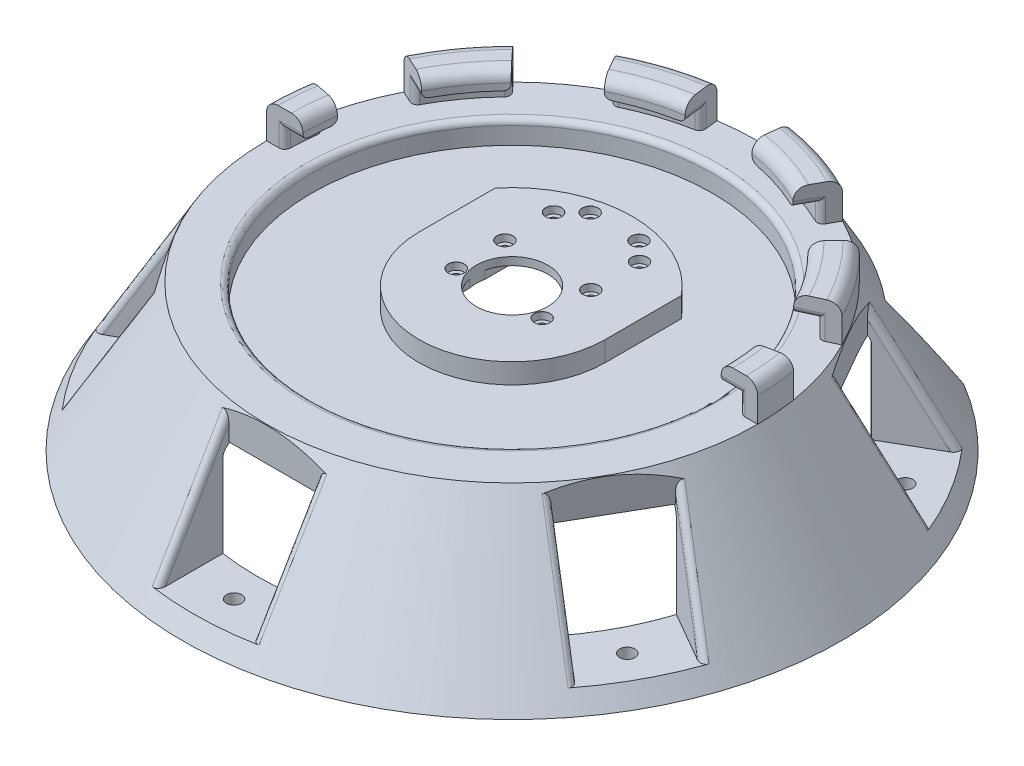
from build123d import *

# Parameters (mm, degrees)
SKETCH2_R                       = 12.5
CUT_EXTRUDE1_DEPTH              = 171.457229262
SKETCH3_R                       = 69.999999954
CUT_EXTRUDE2_DEPTH              = 8.000000002
CUT_EXTRUDE5_DEPTH              = 39
SKETCH8_W                       = 31.75
SKETCH8_H                       = 38.1
CUT_EXTRUDE6_DEPTH              = 44.45
CIRPATTERN2_COUNT               = 6
SKETCH9_R                       = 2.649982
CUT_EXTRUDE7_DEPTH              = 171.457229262
CIRPATTERN3_COUNT               = 6
REVOLVE2_ANGLE                  = 180
CUT_EXTRUDE9_DEPTH              = 12.7
SKETCH3_3_R                     = 12.5
CUT_EXTRUDE11_DEPTH             = 1
CBORE_FOR_M2_5_SHCS1_AT_2_COUNT = 2
CBORE_FOR_M2_5_SHCS1_AT_2_PITCH = 17
CBORE_FOR_M2_5_SHCS1_AT_3_COUNT = 2
CBORE_FOR_M2_5_SHCS1_AT_3_PITCH = 34
CBORE_FOR_M2_5_SHCS1_AT_4_COUNT = 2
CBORE_FOR_M2_5_SHCS1_AT_4_PITCH = 40.820828017
CBORE_FOR_M2_5_SHCS1_AT_5_COUNT = 2
CBORE_FOR_M2_5_SHCS1_AT_5_PITCH = 46.651259361
CBORE_FOR_M2_5_SHCS1_AT_6_COUNT = 2
CBORE_FOR_M2_5_SHCS1_AT_6_PITCH = 45.343136195
CBORE_FOR_M2_5_SHCS1_AT_7_COUNT = 2
CBORE_FOR_M2_5_SHCS1_AT_7_PITCH = 34.481879299
CBORE_FOR_M2_5_SHCS1_AT_8_COUNT = 2
CBORE_FOR_M2_5_SHCS1_AT_8_PITCH = 30
FILLET1_R                       = 4
FILLET2_R                       = 2
FILLET3_R                       = 2
FILLET4_R                       = 2
FILLET5_R                       = 2
FILLET6_R                       = 4
FILLET7_R                       = 4
FILLET8_R                       = 4
FILLET9_R                       = 1
CUT_EXTRUDE12_DEPTH             = 8.05
SKETCH20_W                      = 26.053542
SKETCH20_H                      = 47
CUT_EXTRUDE15_DEPTH             = 5.3


# Some blends are built 0.0001 mm under size
with BuildPart() as part:
    # Sketch1 → Revolve1 (revolve)
    with BuildSketch(Plane.XY, mode=Mode.PRIVATE) as revolve1_sk:
        Polygon((0, 0), (-85.725, 0), (-115.054393675, -50.8), (0, -50.8), align=None)
    revolve(revolve1_sk.sketch.rotate(Axis((0, 0, 0), (0, -1, 0)), 270), axis=Axis((0, 0, 0), (0, -1, 0)))

    # Sketch2 → Cut-Extrude1 (cut, through all)
    with BuildSketch(Plane(origin=(0, 0, 0), x_dir=(1, 0, 0), z_dir=(0, 1, 0))):
        with Locations(Location((0, 0, 0), (0, 0, 270))):
            Circle(SKETCH2_R)
    extrude(amount=-CUT_EXTRUDE1_DEPTH, mode=Mode.SUBTRACT)

    # Sketch3 → Cut-Extrude2 (cut)
    with BuildSketch(Plane(origin=(0, 0, 0), x_dir=(1, 0, 0), z_dir=(0, 1, 0))):
        with Locations(Location((0, 0, 0), (0, 0, 270))):
            Circle(SKETCH3_R)
        with BuildLine():
            ThreePointArc((32.5, 0), (0, -32.5), (-32.5, 0))
            Line((-32.5, 0), (-32.5, 26.603571189))
            ThreePointArc((-32.5, 26.603571189), (0, 42), (32.5, 26.603571189))
            Line((32.5, 26.603571189), (32.5, 0))
        make_face(mode=Mode.SUBTRACT)
    extrude(amount=-CUT_EXTRUDE2_DEPTH, mode=Mode.SUBTRACT)

    # Sketch7 → Cut-Extrude5 (cut)
    with BuildSketch(Plane.XZ.offset(50.8)):
        with BuildLine():
            Line((-62.664330968, -63.058636397), (-62.664330968, -115.023540392))
            Line((-62.664330968, -115.023540392), (57.335669032, -115.023540392))
            Line((57.335669032, -115.023540392), (57.335669032, -67.939907688))
            ThreePointArc((57.335669032, -67.939907688), (3.613220428, 88.826542419), (-62.664330968, -63.058636397))
        make_face()
    extrude(amount=-CUT_EXTRUDE5_DEPTH, mode=Mode.SUBTRACT)


with BuildPart() as cut_extrude5_piece_1:
    # of the separate pieces the step leaves, piece 1, a body of its own (cut_extrude5_pieces)
    add(part.part.solids().sort_by_distance((0, 0, 85.725))[0])

    # Sketch8 → Cut-Extrude6 (cut)
    with BuildSketch(Plane(origin=(0, 0, 0), x_dir=(1, 0, 0), z_dir=(0, 1, 0))):
        with Locations((2.847721453, -104.875)):
            Rectangle(SKETCH8_W, SKETCH8_H)
    cut_extrude6 = extrude(amount=-CUT_EXTRUDE6_DEPTH, mode=Mode.SUBTRACT)

    # CirPattern2: Cut-Extrude6 ×6 about axis, 1 skipped
    cirpattern2_axis = Axis((0, 0, 0), (0, -1, 0))
    add([cut_extrude6.rotate(cirpattern2_axis, i * 360 / CIRPATTERN2_COUNT) for i in range(1, CIRPATTERN2_COUNT) if i not in (3,)], mode=Mode.SUBTRACT)

    # Sketch9 → Cut-Extrude7 (cut, through all)
    with BuildSketch(Plane(origin=(0, 0, 0), x_dir=(1, 0, 0), z_dir=(0, 1, 0))):
        with Locations(Location((2.709157278, -99.772001646, 0), (0, 0, 270))):
            Circle(SKETCH9_R)
    cut_extrude7 = extrude(amount=-CUT_EXTRUDE7_DEPTH, mode=Mode.SUBTRACT)

    # CirPattern3: Cut-Extrude7 ×6 about axis
    cirpattern3_axis = Axis((0, 0, 0), (0, 1, 0))
    for i in range(1, CIRPATTERN3_COUNT):
        add(cut_extrude7.rotate(cirpattern3_axis, i * 360 / CIRPATTERN3_COUNT), mode=Mode.SUBTRACT)

    # Sketch12 → Revolve2 (revolve)
    with BuildSketch(Plane.XY):
        Polygon((85.725, 0), (85.725, 12.7), (73.025, 12.7), (73.025, 6.35), (79.375, 6.35), (79.375, 0), align=None)
    revolve(axis=Axis((0, 0, 0), (0, 1, 0)), revolution_arc=REVOLVE2_ANGLE)

    # Sketch18 → Cut-Extrude9 (cut)
    with BuildSketch(Plane(origin=(0, 12.7, 0), x_dir=(1, 0, 0), z_dir=(0, 1, 0))):
        Polygon((46.643270314, 89.718478222), (70.913780145, 72.084920653), (36.670415564, 35.160782448), (22.108109665, 45.740916989), align=None)
        Polygon((-15, 100), (-9, 50), (9, 50), (15, 100), align=None)
        Polygon((90.470396714, 45.167547182), (99.740906545, 16.635851693), (50.333978764, 6.891341072), (44.771672865, 24.010358365), align=None)
        Polygon((99.740906545, -16.635851693), (90.470396714, -45.167547182), (44.771672865, -24.010358365), (50.333978764, -6.891341072), align=None)
        Polygon((70.913780145, -72.084920653), (46.643270314, -89.718478222), (22.108109665, -45.740916989), (36.670415564, -35.160782448), align=None)
        Polygon((15, -100), (-15, -100), (-9, -50), (9, -50), align=None)
        Polygon((-46.643270314, -89.718478222), (-70.913780145, -72.084920653), (-36.670415564, -35.160782448), (-22.108109665, -45.740916989), align=None)
        Polygon((-90.470396714, -45.167547182), (-99.740906545, -16.635851693), (-50.333978764, -6.891341072), (-44.771672865, -24.010358365), align=None)
        Polygon((-99.740906545, 16.635851693), (-90.470396714, 45.167547182), (-44.771672865, 24.010358365), (-50.333978764, 6.891341072), align=None)
        Polygon((-70.913780145, 72.084920653), (-46.643270314, 89.718478222), (-22.108109665, 45.740916989), (-36.670415564, 35.160782448), align=None)
    extrude(amount=-CUT_EXTRUDE9_DEPTH, mode=Mode.SUBTRACT)

    # Sketch3<3> → Cut-Extrude11 (cut)
    # profile 1 of 5: a face of its own
    with BuildSketch(Plane(origin=(0, 0, 0), x_dir=(1, 0, 0), z_dir=(0, 1, 0))):
        with BuildLine():
            ThreePointArc((-18.668154703, 26.603571189), (-28.835438507, 14.992247533), (-32.5, 0))
            ThreePointArc((-32.5, 0), (0, -32.5), (32.5, 0))
            ThreePointArc((32.5, 0), (28.835438507, 14.992247533), (18.668154703, 26.603571189))
            Line((18.668154703, 26.603571189), (-18.668154703, 26.603571189))
        make_face()
        with Locations(Location((0, 0, 0), (0, 0, 270))):
            Circle(SKETCH3_3_R, mode=Mode.SUBTRACT)
    # profile 2 of 5: a face of its own
    with BuildSketch(Plane(origin=(0, 0, 0), x_dir=(1, 0, 0), z_dir=(0, 1, 0))):
        with BuildLine():
            Line((-32.5, 26.603571189), (-32.5, 0))
            ThreePointArc((-32.5, 0), (-28.835438507, 14.992247533), (-18.668154703, 26.603571189))
            Line((-18.668154703, 26.603571189), (-32.5, 26.603571189))
        make_face()
    # profile 3 of 5: a face of its own
    with BuildSketch(Plane(origin=(0, 0, 0), x_dir=(1, 0, 0), z_dir=(0, 1, 0))):
        with BuildLine():
            ThreePointArc((18.668154703, 26.603571189), (0, 32.5), (-18.668154703, 26.603571189))
            Line((-18.668154703, 26.603571189), (18.668154703, 26.603571189))
        make_face()
    # profile 4 of 5: a face of its own
    with BuildSketch(Plane(origin=(0, 0, 0), x_dir=(1, 0, 0), z_dir=(0, 1, 0))):
        with BuildLine():
            ThreePointArc((32.5, 26.603571189), (0, 42), (-32.5, 26.603571189))
            Line((-32.5, 26.603571189), (-18.668154703, 26.603571189))
            ThreePointArc((-18.668154703, 26.603571189), (0, 32.5), (18.668154703, 26.603571189))
            Line((18.668154703, 26.603571189), (32.5, 26.603571189))
        make_face()
    # profile 5 of 5: a face of its own
    with BuildSketch(Plane(origin=(0, 0, 0), x_dir=(1, 0, 0), z_dir=(0, 1, 0))):
        with BuildLine():
            ThreePointArc((18.668154703, 26.603571189), (28.835438507, 14.992247533), (32.5, 0))
            Line((32.5, 0), (32.5, 26.603571189))
            Line((32.5, 26.603571189), (18.668154703, 26.603571189))
        make_face()
    extrude(amount=-CUT_EXTRUDE11_DEPTH, mode=Mode.SUBTRACT)

    # Sketch24 → CBORE for M2.5 SHCS1 (revolve, cut)
    with BuildSketch(Plane(origin=(-15, -1, 4.5), x_dir=(0, 0, 1), z_dir=(1, 0, 0))):
        Polygon((0, 0), (0, 49.8), (1.45, 49.8), (1.45, 2.5), (2.75, 2.5), (2.75, 0.025), (2.775, 0), align=None)
    cbore_for_m2_5_shcs1 = revolve(axis=Axis((-15, 5.35, 4.5), (0, -1, 0)), mode=Mode.SUBTRACT)

    # CBORE for M2.5 SHCS1 at 2: CBORE for M2.5 SHCS1 ×2
    with Locations(*[(0, 0, -i * CBORE_FOR_M2_5_SHCS1_AT_2_PITCH) for i in range(1, CBORE_FOR_M2_5_SHCS1_AT_2_COUNT)]):
        add(cbore_for_m2_5_shcs1, mode=Mode.SUBTRACT)

    # CBORE for M2.5 SHCS1 at 3: CBORE for M2.5 SHCS1 ×2
    with Locations(*[(0, 0, -i * CBORE_FOR_M2_5_SHCS1_AT_3_PITCH) for i in range(1, CBORE_FOR_M2_5_SHCS1_AT_3_COUNT)]):
        add(cbore_for_m2_5_shcs1, mode=Mode.SUBTRACT)

    # CBORE for M2.5 SHCS1 at 4: CBORE for M2.5 SHCS1 ×2
    with Locations(*[Vector(0.15923243882462063, 0, -0.9872411207126472) * (i * CBORE_FOR_M2_5_SHCS1_AT_4_PITCH) for i in range(1, CBORE_FOR_M2_5_SHCS1_AT_4_COUNT)]):
        add(cbore_for_m2_5_shcs1, mode=Mode.SUBTRACT)

    # CBORE for M2.5 SHCS1 at 5: CBORE for M2.5 SHCS1 ×2
    with Locations(*[Vector(0.5037377408822789, 0, -0.8638566364917376) * (i * CBORE_FOR_M2_5_SHCS1_AT_5_PITCH) for i in range(1, CBORE_FOR_M2_5_SHCS1_AT_5_COUNT)]):
        add(cbore_for_m2_5_shcs1, mode=Mode.SUBTRACT)

    # CBORE for M2.5 SHCS1 at 6: CBORE for M2.5 SHCS1 ×2
    with Locations(*[Vector(0.6616216370868465, 0, -0.7498378553650925) * (i * CBORE_FOR_M2_5_SHCS1_AT_6_PITCH) for i in range(1, CBORE_FOR_M2_5_SHCS1_AT_6_COUNT)]):
        add(cbore_for_m2_5_shcs1, mode=Mode.SUBTRACT)

    # CBORE for M2.5 SHCS1 at 7: CBORE for M2.5 SHCS1 ×2
    with Locations(*[Vector(0.8700221858486125, 0, -0.4930125719808802) * (i * CBORE_FOR_M2_5_SHCS1_AT_7_PITCH) for i in range(1, CBORE_FOR_M2_5_SHCS1_AT_7_COUNT)]):
        add(cbore_for_m2_5_shcs1, mode=Mode.SUBTRACT)

    # CBORE for M2.5 SHCS1 at 8: CBORE for M2.5 SHCS1 ×2
    with Locations(*[(i * CBORE_FOR_M2_5_SHCS1_AT_8_PITCH, 0, 0) for i in range(1, CBORE_FOR_M2_5_SHCS1_AT_8_COUNT)]):
        add(cbore_for_m2_5_shcs1, mode=Mode.SUBTRACT)

    # Fillet1
    fillet1_edges = [cut_extrude5_piece_1.edges().sort_by_distance(p)[0] for p in [
        (-85.450905057, 12.7, -6.849704366),
        (-72.808821363, 12.7, -5.614815819),
        (-59.078466014, 12.7, -42.923018049),
        (-22.565966014, 12.7, -69.450902102),
        (22.565966014, 12.7, -69.450902102),
        (59.078466014, 12.7, -42.923018049),
        (72.808821363, 12.7, -5.614815819),
        (-69.352981843, 12.7, -50.387890753),
        (-26.490481843, 12.7, -81.529319859),
        (26.490481843, 12.7, -81.529319859),
        (69.352981843, 12.7, -50.387890753),
        (85.450905057, 12.7, -6.849704365),
    ]]
    fillet(fillet1_edges, radius=FILLET1_R)

    # Fillet2
    fillet2_edges = [cut_extrude5_piece_1.edges().sort_by_distance(p)[0] for p in [
        (-76.2, 6.35, 0),
        (76.2, 6.35, 0),
        (67.844410645, 6.35, -34.692369341),
        (75.278944251, 6.35, -11.811227656),
        (34.49561812, 6.35, -67.9446604),
        (53.95947979, 6.35, -53.803337137),
        (-75.278944251, 6.35, -11.811227656),
        (-67.844410645, 6.35, -34.692369341),
        (-53.95947979, 6.35, -53.803337137),
        (-34.49561812, 6.35, -67.9446604),
        (12.029328065, 6.35, -75.24440054),
        (-12.029328065, 6.35, -75.24440054),
    ]]
    fillet(fillet2_edges, radius=FILLET2_R)

    # Fillet3
    fillet3_edges = [cut_extrude5_piece_1.edges().sort_by_distance(p)[0] for p in [
        (-78.396323126, 4.175, -12.426067172),
        (-56.120098678, 4.175, -56.133102082),
        (-70.727816733, 4.175, -36.027303052),
        (-12.407903987, 4.175, -78.399199892),
        (56.120098678, 4.175, -56.133102082),
        (78.396323126, 4.175, -12.426067171),
        (-79.375, 4.175, 0),
        (-36.043688298, 4.175, -70.719468033),
        (12.407903987, 4.175, -78.399199892),
        (36.043688298, 4.175, -70.719468033),
        (70.727816733, 4.175, -36.027303052),
        (79.375, 4.175, 0),
    ]]
    fillet(fillet3_edges, radius=FILLET3_R)

    # Fillet4
    fillet4_edges = [cut_extrude5_piece_1.edges().sort_by_distance(p)[0] for p in [
        (-75.365185269, -24.048119846, 65.131246544),
        (-91.587349698, -23.156988252, 37.835375451),
        (18.722721453, -24.048119846, 97.833788276),
        (-13.027278547, -23.156988252, 98.234659229),
        (94.087906722, -24.048119846, 32.702541732),
        (78.560071151, -23.156988252, 60.399283779),
        (75.365185269, -24.048119846, -65.131246544),
        (91.587349698, -23.156988252, -37.835375451),
        (-94.087906722, -24.048119846, -32.702541732),
        (-78.560071151, -23.156988252, -60.399283779),
    ]]
    fillet(fillet4_edges, radius=FILLET4_R)

    # Fillet5
    fillet5_edges = [cut_extrude5_piece_1.edges().sort_by_distance(p)[0] for p in [
        (0, 0, -69.999999954),
    ]]
    fillet(fillet5_edges, radius=FILLET5_R)

    # Fillet6
    # the kernel refuses this fillet: 4 mm, written as the material it adds along each edge
    with BuildSketch(Plane(origin=(0, -11.8, 0), x_dir=(-0.03456665884949972, 0, 0.9994023944818136), z_dir=(0.9994023944818136, 0, 0.03456665884949972))) as fillet6_piece_1_section:
        with BuildLine():
            CenterArc((88.9 - FILLET6_R, FILLET6_R), FILLET6_R, 270, 90)
            Line((88.9, FILLET6_R), (88.9, 0))
            Line((88.9, 0), (88.9 - FILLET6_R, 0))
        make_face()
    fillet6_piece_1 = revolve(axis=Axis((0, -11.8, 0), (0, -1, 0)), revolution_arc=52.306780187, mode=Mode.PRIVATE)
    fillet6_piece_1 = split(fillet6_piece_1, bisect_by=Plane(origin=(-55.212231486, -12.931781051, 53.495933253), z_dir=(0.5000000000000001, 0, 0.8660254037844386)), keep=Keep.TOP, mode=Mode.PRIVATE)
    fillet6_piece_1 = split(fillet6_piece_1, bisect_by=Plane(origin=(-13.027278547, -12.931781051, 77.377670206), z_dir=(-1, 0, 0)), keep=Keep.TOP, mode=Mode.PRIVATE)
    add(fillet6_piece_1)
    with BuildSketch(Plane(origin=(0, -11.8, 0), x_dir=(0.8827911916489972, 0, -0.4697655925532897), z_dir=(-0.4697655925532897, 0, -0.8827911916489972))) as fillet6_piece_2_section:
        with BuildLine():
            CenterArc((88.9 - FILLET6_R, FILLET6_R), FILLET6_R, 270, 90)
            Line((88.9, FILLET6_R), (88.9, 0))
            Line((88.9, 0), (88.9 - FILLET6_R, 0))
        make_face()
    fillet6_piece_2 = revolve(axis=Axis((0, -11.8, 0), (0, -1, 0)), revolution_arc=52.306780187, mode=Mode.PRIVATE)
    fillet6_piece_2 = split(fillet6_piece_2, bisect_by=Plane(origin=(73.524667357, -12.931781051, -27.406880939), z_dir=(0.5000000000000004, 0, 0.8660254037844384)), keep=Keep.TOP, mode=Mode.PRIVATE)
    fillet6_piece_2 = split(fillet6_piece_2, bisect_by=Plane(origin=(73.934952939, -12.931781051, 21.06722844), z_dir=(0.5000000000000001, 0, -0.8660254037844386)), keep=Keep.TOP, mode=Mode.PRIVATE)
    add(fillet6_piece_2)
    with BuildSketch(Plane(origin=(0, -11.8, 0), x_dir=(0.8482245327994972, 0, 0.5296368019285242), z_dir=(0.5296368019285242, 0, -0.8482245327994972))) as fillet6_piece_3_section:
        with BuildLine():
            CenterArc((88.9 - FILLET6_R, FILLET6_R), FILLET6_R, 270, 90)
            Line((88.9, FILLET6_R), (88.9, 0))
            Line((88.9, 0), (88.9 - FILLET6_R, 0))
        make_face()
    fillet6_piece_3 = revolve(axis=Axis((0, -11.8, 0), (0, -1, 0)), revolution_arc=52.306780187, mode=Mode.PRIVATE)
    fillet6_piece_3 = split(fillet6_piece_3, bisect_by=Plane(origin=(18.722721453, -12.931781051, 74.563161693), z_dir=(1, 0, 0)), keep=Keep.TOP, mode=Mode.PRIVATE)
    fillet6_piece_3 = split(fillet6_piece_3, bisect_by=Plane(origin=(60.49738881, -12.931781051, 49.970789267), z_dir=(-0.5000000000000001, 0, 0.8660254037844386)), keep=Keep.TOP, mode=Mode.PRIVATE)
    add(fillet6_piece_3)
    with BuildSketch(Plane(origin=(0, -11.8, 0), x_dir=(-0.8827911916489969, 0, 0.4697655925532904), z_dir=(0.4697655925532904, 0, 0.8827911916489969))) as fillet6_piece_4_section:
        with BuildLine():
            CenterArc((88.9 - FILLET6_R, FILLET6_R), FILLET6_R, 270, 90)
            Line((88.9, FILLET6_R), (88.9, 0))
            Line((88.9, 0), (88.9 - FILLET6_R, 0))
        make_face()
    fillet6_piece_4 = revolve(axis=Axis((0, -11.8, 0), (0, -1, 0)), revolution_arc=52.306780187, mode=Mode.PRIVATE)
    fillet6_piece_4 = split(fillet6_piece_4, bisect_by=Plane(origin=(-73.524667357, -12.931781051, 27.406880939), z_dir=(-0.5000000000000001, 0, -0.8660254037844386)), keep=Keep.TOP, mode=Mode.PRIVATE)
    fillet6_piece_4 = split(fillet6_piece_4, bisect_by=Plane(origin=(-73.934952939, -12.931781051, -21.06722844), z_dir=(-0.49999999999999983, 0, 0.8660254037844388)), keep=Keep.TOP, mode=Mode.PRIVATE)
    add(fillet6_piece_4)

    # Fillet7
    fillet7_edges = [cut_extrude5_piece_1.edges().sort_by_distance(p)[0] for p in [
        (61.757268531, -11.8, -63.947242189),
    ]]
    fillet(fillet7_edges, radius=FILLET7_R - 0.0001)  # a hair under: the kernel refuses the full size

    # Fillet8
    fillet8_edges = [cut_extrude5_piece_1.edges().sort_by_distance(p)[0] for p in [
        (-66.269671974, -11.8, -59.258253235),
    ]]
    fillet(fillet8_edges, radius=FILLET8_R - 0.0001)  # a hair under: the kernel refuses the full size

    # Fillet9
    fillet9_edges = [cut_extrude5_piece_1.edges().sort_by_distance(p)[0] for p in [
        (57.335669032, -31.144788273, -86.41556122),
        (-62.664330968, -31.083296156, -82.588421552),
    ]]
    fillet(fillet9_edges, radius=FILLET9_R)

    # Sketch28 → Cut-Extrude12 (cut)
    with BuildSketch(Plane.XZ.offset(11.8)):
        with BuildLine():
            Line((9.2, 12), (-9.2, 12))
            ThreePointArc((-9.2, 12), (-11.321320344, 11.121320344), (-12.2, 9))
            Line((-12.2, 9), (-12.2, -30))
            ThreePointArc((-12.2, -30), (-11.321320344, -32.121320344), (-9.2, -33))
            Line((-9.2, -33), (9.2, -33))
            ThreePointArc((9.2, -33), (11.321320344, -32.121320344), (12.2, -30))
            Line((12.2, -30), (12.2, 9))
            ThreePointArc((12.2, 9), (11.321320344, 11.121320344), (9.2, 12))
        make_face()
    extrude(amount=-CUT_EXTRUDE12_DEPTH, mode=Mode.SUBTRACT)

    # Sketch20 → Cut-Extrude15 (cut)
    # profile 1 of 2: a face of its own
    with BuildSketch(Plane.XZ.offset(11.8)):
        Polygon((-22.5, 20), (-22.5, -33), (-12.5, -40), (12.5, -40), (22.5, -33), (22.5, 20), align=None)
        with Locations((0, -10.5)):
            Rectangle(SKETCH20_W, SKETCH20_H, mode=Mode.SUBTRACT)
    # profile 2 of 2: a face of its own
    with BuildSketch(Plane.XZ.offset(11.8)):
        with Locations((0, -10.5)):
            Rectangle(SKETCH20_W, SKETCH20_H)
    extrude(amount=-CUT_EXTRUDE15_DEPTH, mode=Mode.SUBTRACT)


with BuildPart() as cut_extrude5_piece_2:
    # of the separate pieces the step leaves, piece 2, a body of its own (cut_extrude5_pieces)
    add(part.part.solids().sort_by_distance((-2.664330968, -50.8, -115.023540392))[0])


solid = Compound([cut_extrude5_piece_1.part, cut_extrude5_piece_2.part])
